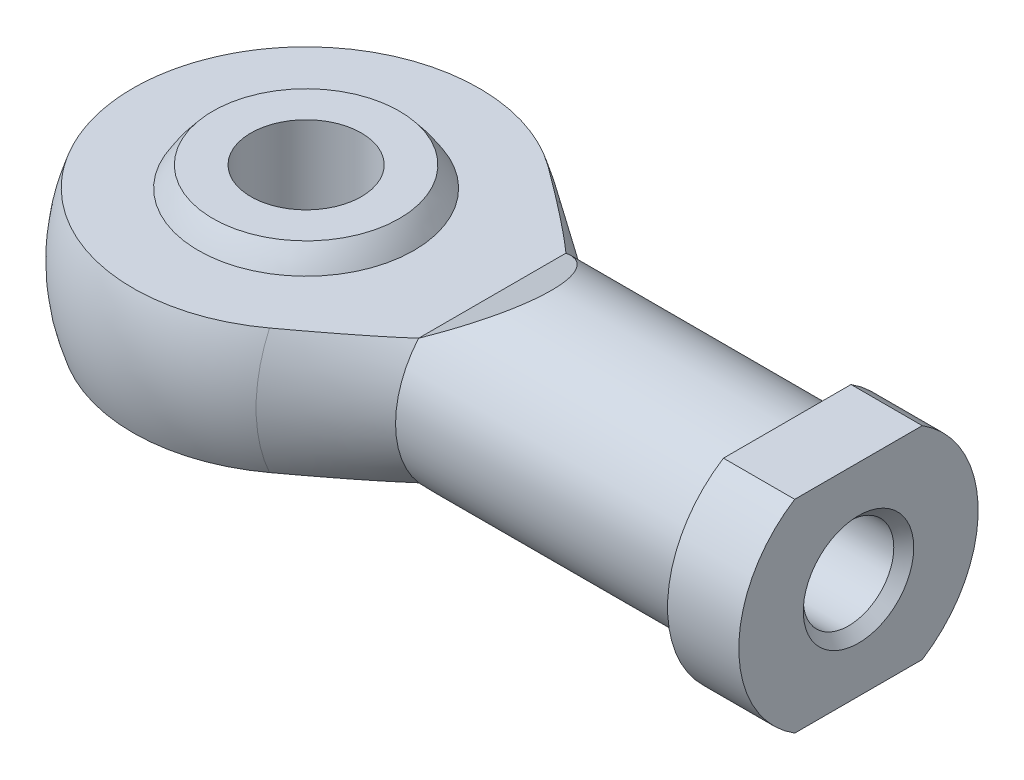
from build123d import *

# Parameters (mm, degrees)
SCHNITT_LINEAR_AUSTRAGEN1_DEPTH      = 10
SCHNITT_LINEAR_AUSTRAGEN1_DEPTH_BACK = 10
SCHNITT_LINEAR_AUSTRAGEN2_DEPTH      = 12
SCHNITT_LINEAR_AUSTRAGEN2_DEPTH_BACK = 12
BOHRUNG1_D                           = 4.917
BOHRUNG1_DEPTH                       = 15
BOHRUNG1_CSINK_D                     = 6
BOHRUNG1_CSINK_ANGLE                 = 90
BOHRUNG1_TIP                         = 1.419415637


with BuildPart() as part:
    # Skizze1 → Rotation1 (revolve)
    with BuildSketch(Plane.XY):
        with BuildLine():
            Line((5.580448961, 8.298107579), (10.11, 5.252))
            Line((10.11, 5.252), (26.13, 5.252))
            Line((26.13, 5.252), (26.13, 6.5))
            Line((26.13, 6.5), (30, 6.5))
            Line((30, 6.5), (30, 0))
            Line((30, 0), (-10, 0))
            ThreePointArc((-10, 0), (-4.700824948, 8.826224833), (5.580448961, 8.298107579))
        make_face()
    revolve(axis=Axis((30, 0, 0), (-1, 0, 0)))

    # Skizze2 → Schnitt-Linear austragen1 (cut, two sides: drawn at the far end of the back side and taken through both)
    with BuildSketch(Plane.XY.offset(-SCHNITT_LINEAR_AUSTRAGEN1_DEPTH_BACK)):
        Polygon((-12, -10.1), (21.714740411, -10.1), (10.11, -3.4), (-11, -3.4), (-11, 3.4), (10.11, 3.4), (21.714740411, 10.1), (-12, 10.1), align=None)
    extrude(amount=SCHNITT_LINEAR_AUSTRAGEN1_DEPTH + SCHNITT_LINEAR_AUSTRAGEN1_DEPTH_BACK, mode=Mode.SUBTRACT)

    # Skizze3 → Schnitt-Linear austragen2 (cut, two sides: drawn at the far end of the back side and taken through both)
    with BuildSketch(Plane(origin=(30, 0, 0), x_dir=(0, 0, -1), z_dir=(1, 0, 0)).offset(-SCHNITT_LINEAR_AUSTRAGEN2_DEPTH_BACK)):
        Polygon((10.5, -10.5), (10.5, -5.5), (-8.5, -5.5), (-8.5, 5.5), (10.5, 5.5), (10.5, 10.5), (-10.5, 10.5), (-10.5, -10.5), align=None)
    extrude(amount=SCHNITT_LINEAR_AUSTRAGEN2_DEPTH + SCHNITT_LINEAR_AUSTRAGEN2_DEPTH_BACK, mode=Mode.SUBTRACT)

    # Bohrung1
    with Locations(Plane(origin=(30, 0, 0), x_dir=(0, 0, -1), z_dir=(1, 0, 0))):
        with Locations((0, 0)):
            CounterSinkHole(BOHRUNG1_D / 2, BOHRUNG1_CSINK_D / 2, depth=BOHRUNG1_DEPTH, counter_sink_angle=BOHRUNG1_CSINK_ANGLE)
            with Locations((0, 0, -(BOHRUNG1_DEPTH + BOHRUNG1_TIP / 2))):  # 120° drill point
                Cone(0, BOHRUNG1_D / 2, BOHRUNG1_TIP, mode=Mode.SUBTRACT)

    # Skizze6 → Schnitt-Rotation1 (revolve, cut)
    with BuildSketch(Plane.XY):
        with BuildLine():
            Line((0, 3.4), (5.592209671, 3.4))
            ThreePointArc((5.592209671, 3.4), (5.436377447, 3.31009061), (5.436220558, 3.130181311))
            ThreePointArc((5.436220558, 3.130181311), (6.273, 0), (5.436220558, -3.130181311))
            ThreePointArc((5.436220558, -3.130181311), (5.436377447, -3.31009061), (5.592209671, -3.4))
            Line((5.592209671, -3.4), (0, -3.4))
            Line((0, -3.4), (0, 3.4))
        make_face()
    revolve(axis=Axis((0, -3.4, 0), (0, 1, 0)), mode=Mode.SUBTRACT)

    # Skizze7 → Rotation2 (revolve)
    with BuildSketch(Plane.XY):
        with BuildLine():
            Line((3, 4.5), (3, -4.5))
            Line((3, -4.5), (5.061968886, -4.5))
            ThreePointArc((5.061968886, -4.5), (6.773, 0), (5.061968886, 4.5))
            Line((5.061968886, 4.5), (3, 4.5))
        make_face()
    revolve(axis=Axis((0, -4.5, 0), (0, 1, 0)))


solid = part.part
